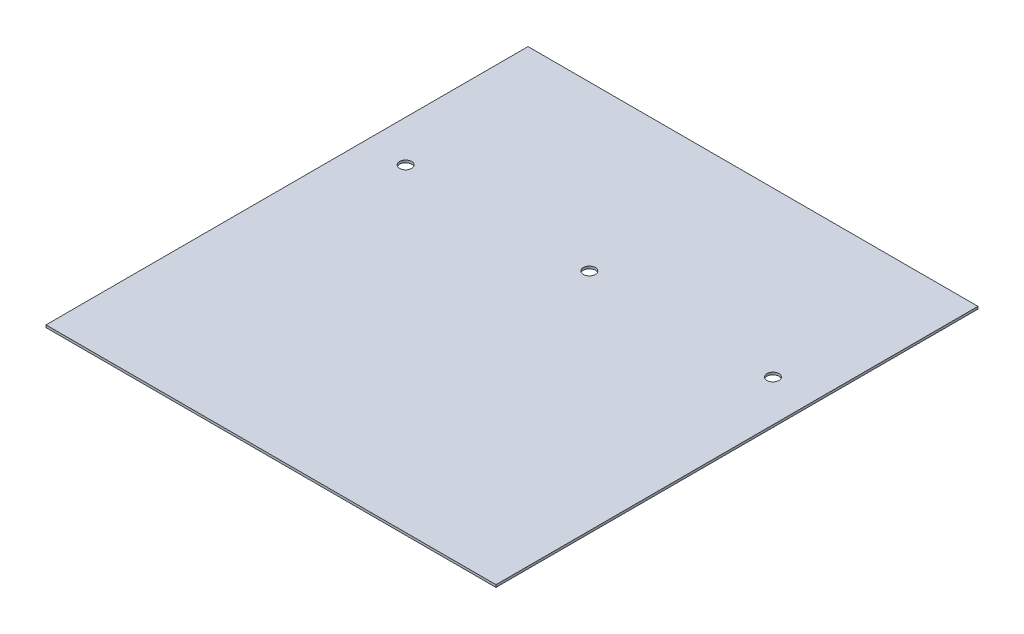
from build123d import *

# Parameters (mm, degrees)
SKETCH1_W           = 186.69
SKETCH1_H           = 199.9996
SKETCH1_R           = 2.5
BOSS_EXTRUDE1_DEPTH = 1


with BuildPart() as part:
    # Sketch1 → Boss-Extrude1 (new body)
    with BuildSketch(Plane(origin=(0, 0, 0), x_dir=(1, 0, 0), z_dir=(0, 1, 0))):
        with Locations((93.345, -99.9998)):
            Rectangle(SKETCH1_W, SKETCH1_H)
        with Locations((17.145, -67.9196)):
            Circle(SKETCH1_R, mode=Mode.SUBTRACT)
        with Locations((93.345, -67.9196)):
            Circle(SKETCH1_R, mode=Mode.SUBTRACT)
        with Locations((169.545, -67.9196)):
            Circle(SKETCH1_R, mode=Mode.SUBTRACT)
    extrude(amount=-BOSS_EXTRUDE1_DEPTH)


solid = part.part
